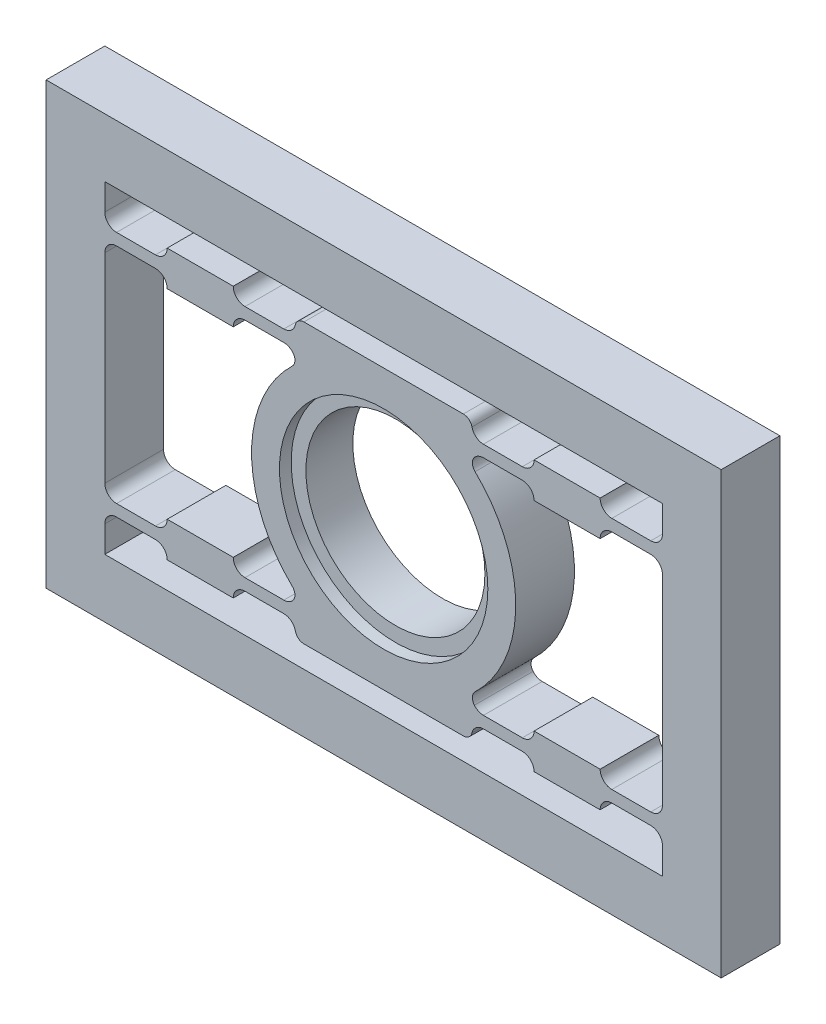
from build123d import *

# Parameters (mm, degrees)
SKETCH_2_R      = 7.1
SKETCH_2_R_2    = 6.1
EXTRUDE_1_DEPTH = 3.2
SKETCH_2_3_R    = 9
SKETCH_2_3_R_2  = 7.1
EXTRUDE_2_DEPTH = 4
EXTRUDE_3_DEPTH = 4
SKETCH_4_W      = 46
SKETCH_4_H      = 30
SKETCH_4_W_2    = 38
SKETCH_4_H_2    = 22
EXTRUDE_4_DEPTH = 4
SKETCH_5_W      = 13
SKETCH_5_H      = 0.8
SKETCH_5_W_2    = 4.5
SKETCH_5_H_2    = 2.4
EXTRUDE_5_DEPTH = 4
FILLET_1_R      = 0.8
FILLET_2_R      = 0.6


with BuildPart() as part:
    # 草图2 → 凸台-拉伸1 (new body)
    with BuildSketch(Plane.XY):
        Circle(SKETCH_2_R)
        Circle(SKETCH_2_R_2, mode=Mode.SUBTRACT)
    extrude(amount=EXTRUDE_1_DEPTH)

    # 草图2<3> → 凸台-拉伸2 (add)
    with BuildSketch(Plane.XY):
        Circle(SKETCH_2_3_R)
        Circle(SKETCH_2_3_R_2, mode=Mode.SUBTRACT)
    extrude(amount=EXTRUDE_2_DEPTH)

    # 草图3 → 凸台-拉伸3 (add)
    with BuildSketch(Plane.XY):
        with BuildLine():
            Line((6, 6.708203932), (6, 9.5))
            Line((6, 9.5), (-6, 9.5))
            Line((-6, 9.5), (-6, 6.708203932))
            ThreePointArc((-6, 6.708203932), (0, 9), (6, 6.708203932))
        make_face()
        with BuildLine():
            Line((-6, -9.5), (6, -9.5))
            Line((6, -9.5), (6, -6.708203932))
            ThreePointArc((6, -6.708203932), (0, -9), (-6, -6.708203932))
            Line((-6, -6.708203932), (-6, -9.5))
        make_face()
    extrude(amount=EXTRUDE_3_DEPTH)



with BuildPart() as body_2:
    # 草图4 → 凸台-拉伸4 (new body)
    with BuildSketch(Plane.XY):
        Rectangle(SKETCH_4_W, SKETCH_4_H)
        Rectangle(SKETCH_4_W_2, SKETCH_4_H_2, mode=Mode.SUBTRACT)
    extrude(amount=EXTRUDE_4_DEPTH)


with BuildPart() as part_1:
    add(part.part)

    add(body_2.part)  # 凸台-拉伸5 merges body 2
    # 草图5 → 凸台-拉伸5 (add)
    with BuildSketch(Plane.XY):
        with Locations((-12.5, 8)):
            Rectangle(SKETCH_5_W, SKETCH_5_H)
        with Locations((12.5, 8)):
            Rectangle(SKETCH_5_W, SKETCH_5_H)
        with Locations((-12.5, -8)):
            Rectangle(SKETCH_5_W, SKETCH_5_H)
        with Locations((12.5, -8)):
            Rectangle(SKETCH_5_W, SKETCH_5_H)
        with Locations((12.5, 8)):
            Rectangle(SKETCH_5_W_2, SKETCH_5_H_2)
        with Locations((-12.5, 8)):
            Rectangle(SKETCH_5_W_2, SKETCH_5_H_2)
        with Locations((12.5, -8)):
            Rectangle(SKETCH_5_W_2, SKETCH_5_H_2)
        with Locations((-12.5, -8)):
            Rectangle(SKETCH_5_W_2, SKETCH_5_H_2)
    extrude(amount=EXTRUDE_5_DEPTH)

    # 圆角1
    fillet_1_edges = [part_1.edges().sort_by_distance(p)[0] for p in [
        (19, 7.6, 2),
        (19, -7.6, 2),
        (-19, -7.6, 2),
        (-19, 7.6, 2),
        (-6, 7.6, 2),
        (6, 7.6, 2),
        (6, -7.6, 2),
        (-6, -7.6, 2),
        (-6, -8.4, 2),
        (6, -8.4, 2),
        (6, 8.4, 2),
        (-6, 8.4, 2),
        (-19, 8.4, 2),
        (19, 8.4, 2),
        (-19, -8.4, 2),
        (19, -8.4, 2),
        (-10.25, 7.6, 2),
        (-10.25, 8.4, 2),
        (-14.75, 8.4, 2),
        (-14.75, 7.6, 2),
        (14.75, 7.6, 2),
        (14.75, 8.4, 2),
        (10.25, 8.4, 2),
        (10.25, 7.6, 2),
        (14.75, -8.4, 2),
        (14.75, -7.6, 2),
        (10.25, -7.6, 2),
        (10.25, -8.4, 2),
        (-10.25, -8.4, 2),
        (-10.25, -7.6, 2),
        (-14.75, -7.6, 2),
        (-14.75, -8.4, 2),
    ]]
    fillet(fillet_1_edges, radius=FILLET_1_R - 0.0001)  # a hair under: the kernel refuses the full size

    # 圆角2
    fillet_2_edges = [part_1.edges().sort_by_distance(p)[0] for p in [
        (-6, -9.5, 2),
        (6, 9.5, 2),
        (6, -9.5, 2),
        (-6, 9.5, 2),
        (6, -6.708203932, 2),
        (-6, 6.708203932, 2),
        (6, 6.708203932, 2),
        (-6, -6.708203932, 2),
    ]]
    fillet(fillet_2_edges, radius=FILLET_2_R)


solid = part_1.part
